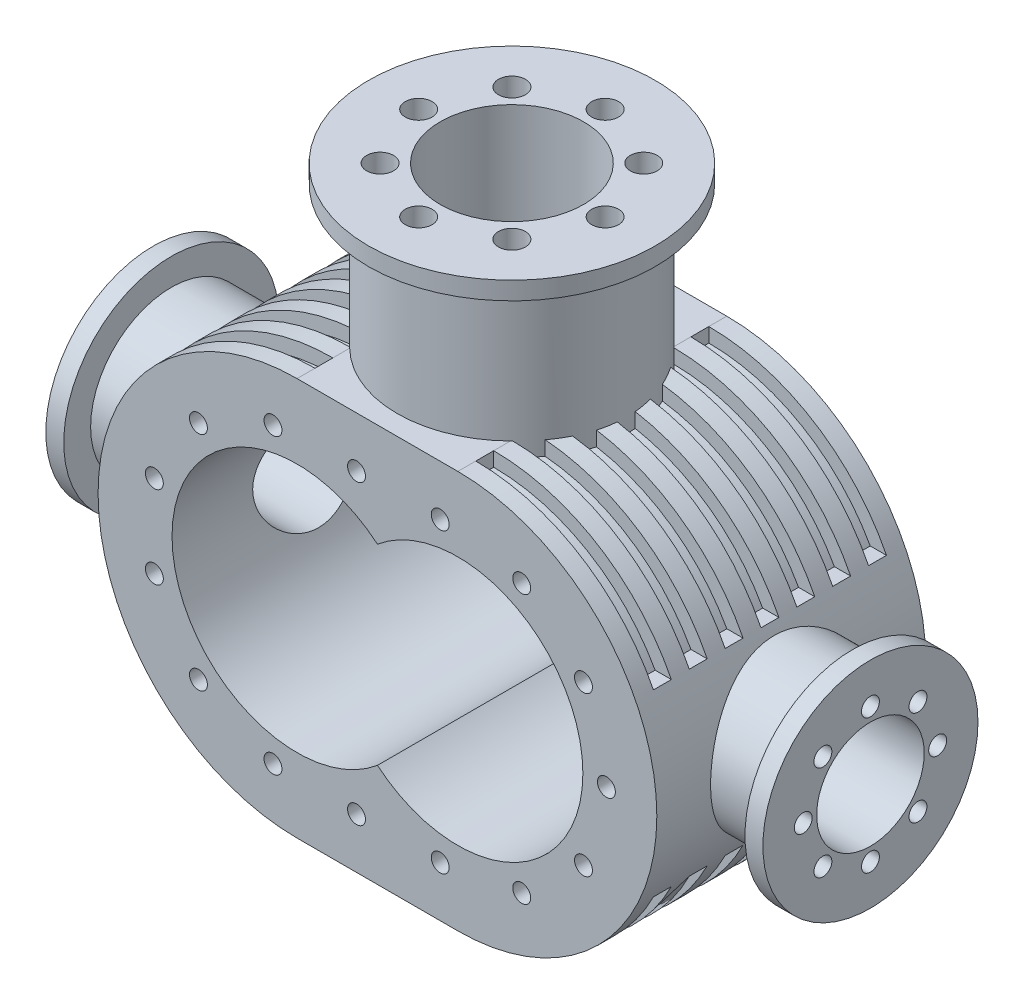
from build123d import *

# Parameters (mm, degrees)
BOSS_EXTRUDE1_DEPTH      = 75
SKETCH3_R                = 5
CUT_EXTRUDE1_DEPTH       = 30
CRVPATTERN1_START        = 45
CRVPATTERN1_OUTLINE_R    = 5
CRVPATTERN1_DEPTH        = 30
BOSS_EXTRUDE2_REACH      = 382.226
BOSS_EXTRUDE2_END_RADIUS = 111
SKETCH4_R                = 45
SKETCH4_3_R              = 60
SKETCH4_3_R_2            = 45
BOSS_EXTRUDE3_DEPTH      = 10
CUT_EXTRUDE2_REACH       = 382.226
CUT_EXTRUDE2_END_RADIUS  = 69.75
SKETCH4_4_R              = 30
SKETCH5_R                = 5
CUT_EXTRUDE3_DEPTH       = 30
SKETCH6_R                = 64
SKETCH6_R_2              = 40
BOSS_EXTRUDE6_DEPTH      = 89
CUT_EXTRUDE4_REACH       = 379.288
SKETCH6_4_R              = 40
SKETCH6_5_R              = 80
SKETCH6_5_R_2            = 64
BOSS_EXTRUDE9_DEPTH      = 10
SKETCH12_R               = 7.5
CUT_EXTRUDE5_DEPTH       = 40
CUT_EXTRUDE6_DEPTH       = 294.93876927
CUT_EXTRUDE6_DEPTH_BACK  = 294.93876927
BOSS_EXTRUDE11_START     = -10
BOSS_EXTRUDE11_DEPTH     = 10
CUT_EXTRUDE7_DEPTH       = 323.529068581
CUT_EXTRUDE7_DEPTH_BACK  = 10
SKETCH18_R               = 10
BOSS_EXTRUDE12_START     = 65
BOSS_EXTRUDE12_DEPTH     = 10
LPATTERN1_COUNT          = 8
LPATTERN1_PITCH          = 20
BOSS_EXTRUDE13_REACH     = 311.328


# Read off the part's stored shape, not the designer's step: CrvPattern1
with BuildPart() as part:
    # Sketch1 → Boss-Extrude1 (new, symmetric)
    with BuildSketch(Plane.XY):
        with BuildLine():
            Line((-44.845, -111), (44.845, -111))
            ThreePointArc((44.845, -111), (155.845, 0), (44.845, 111))
            Line((44.845, 111), (-44.845, 111))
            ThreePointArc((-44.845, 111), (-155.845, 0), (-44.845, -111))
        make_face()
        with BuildLine():
            ThreePointArc((0, -53.422733691), (114.595, 0), (0, 53.422733691))
            ThreePointArc((0, 53.422733691), (-114.595, 0), (0, -53.422733691))
        make_face(mode=Mode.SUBTRACT)
    extrude(amount=BOSS_EXTRUDE1_DEPTH, both=True)

    # Sketch3 → Cut-Extrude1 (cut)
    with BuildSketch(Plane.XY.offset(75)):
        with Locations((127.72, 0)):
            Circle(SKETCH3_R)
    extrude(amount=-CUT_EXTRUDE1_DEPTH, mode=Mode.SUBTRACT)

    # CrvPattern1 outline → CrvPattern1 (cut)
    with BuildSketch(Plane.XY.offset(CRVPATTERN1_START)):
        with Locations((114.921070285, 44.244886692)):
            Circle(CRVPATTERN1_OUTLINE_R)
        with Locations((114.921070285, -44.244886692)):
            Circle(CRVPATTERN1_OUTLINE_R)
        with Locations((80.477526434, -74.823717396)):
            Circle(CRVPATTERN1_OUTLINE_R)
        with Locations((35.004949117, -82.875)):
            Circle(CRVPATTERN1_OUTLINE_R)
        with Locations((-11.668316372, -82.875)):
            Circle(CRVPATTERN1_OUTLINE_R)
        with Locations((-58.282002325, -81.778435993)):
            Circle(CRVPATTERN1_OUTLINE_R)
        with Locations((-99.866296576, -61.97517687)):
            Circle(CRVPATTERN1_OUTLINE_R)
        with Locations((-124.455991546, -23.029451797)):
            Circle(CRVPATTERN1_OUTLINE_R)
        with Locations((-124.455991546, 23.029451797)):
            Circle(CRVPATTERN1_OUTLINE_R)
        with Locations((-99.866296576, 61.97517687)):
            Circle(CRVPATTERN1_OUTLINE_R)
        with Locations((-58.282002325, 81.778435993)):
            Circle(CRVPATTERN1_OUTLINE_R)
        with Locations((-11.668316372, 82.875)):
            Circle(CRVPATTERN1_OUTLINE_R)
        with Locations((35.004949117, 82.875)):
            Circle(CRVPATTERN1_OUTLINE_R)
        with Locations((80.477526434, 74.823717396)):
            Circle(CRVPATTERN1_OUTLINE_R)
    extrude(amount=CRVPATTERN1_DEPTH, mode=Mode.SUBTRACT)

    # Boss-Extrude2: up to this cylinder (the profile starts outside it)
    boss_extrude2_end = Plane(origin=(44.845, 0, 0), z_dir=(0, 0, -1)) * Cylinder(BOSS_EXTRUDE2_END_RADIUS, 987.452, mode=Mode.PRIVATE)
    # Sketch4 → Boss-Extrude2 (add, up to the surface)
    with BuildSketch(Plane(origin=(200, 0, 0), x_dir=(0, 0, -1), z_dir=(1, 0, 0)), mode=Mode.PRIVATE) as boss_extrude2_sk1:
        Circle(SKETCH4_R)
    boss_extrude2_tool1 = extrude(boss_extrude2_sk1.sketch, amount=-BOSS_EXTRUDE2_REACH, mode=Mode.PRIVATE) - boss_extrude2_end
    boss_extrude2 = boss_extrude2_tool1.solids().sort_by_distance((200, 0, 0))[0]
    add(boss_extrude2)

    # Sketch4<3> → Boss-Extrude3 (add)
    with BuildSketch(Plane(origin=(200, 0, 0), x_dir=(0, 0, -1), z_dir=(1, 0, 0))):
        Circle(SKETCH4_3_R)
        Circle(SKETCH4_3_R_2, mode=Mode.SUBTRACT)
    boss_extrude3 = extrude(amount=-BOSS_EXTRUDE3_DEPTH)

    # Cut-Extrude2: up to this cylinder (the profile starts outside it)
    cut_extrude2_end = Plane(origin=(44.845, 0, 0), z_dir=(0, 0, -1)) * Cylinder(CUT_EXTRUDE2_END_RADIUS, 904.952, mode=Mode.PRIVATE)
    # Sketch4<4> → Cut-Extrude2 (cut, up to the surface)
    with BuildSketch(Plane(origin=(200, 0, 0), x_dir=(0, 0, -1), z_dir=(1, 0, 0)), mode=Mode.PRIVATE) as cut_extrude2_sk1:
        Circle(SKETCH4_4_R)
    cut_extrude2_tool1 = extrude(cut_extrude2_sk1.sketch, amount=-CUT_EXTRUDE2_REACH, mode=Mode.PRIVATE) - cut_extrude2_end
    cut_extrude2 = cut_extrude2_tool1.solids().sort_by_distance((200, 0, 0))[0]
    add(cut_extrude2, mode=Mode.SUBTRACT)

    # Sketch5 → Cut-Extrude3 (cut)
    with BuildSketch(Plane(origin=(200, 0, 0), x_dir=(0, 0, -1), z_dir=(1, 0, 0))):
        with Locations((0, 37.5)):
            Circle(SKETCH5_R)
        with Locations((26.516504294, 26.516504294)):
            Circle(SKETCH5_R)
        with Locations((37.5, 0)):
            Circle(SKETCH5_R)
        with Locations((26.516504294, -26.516504294)):
            Circle(SKETCH5_R)
        with Locations((0, -37.5)):
            Circle(SKETCH5_R)
        with Locations((-26.516504294, -26.516504294)):
            Circle(SKETCH5_R)
        with Locations((-37.5, 0)):
            Circle(SKETCH5_R)
        with Locations((-26.516504294, 26.516504294)):
            Circle(SKETCH5_R)
    cut_extrude3 = extrude(amount=-CUT_EXTRUDE3_DEPTH, mode=Mode.SUBTRACT)

    # Mirror1: Boss-Extrude2, Boss-Extrude3, Cut-Extrude2, Cut-Extrude3 across plane
    add(boss_extrude2.mirror(Plane(origin=(0, 0, 0), x_dir=(0, 0, 1), z_dir=(1, 0, 0))))
    add(boss_extrude3.mirror(Plane(origin=(0, 0, 0), x_dir=(0, 0, 1), z_dir=(1, 0, 0))))
    add(cut_extrude2.mirror(Plane(origin=(0, 0, 0), x_dir=(0, 0, 1), z_dir=(1, 0, 0))), mode=Mode.SUBTRACT)
    add(cut_extrude3.mirror(Plane(origin=(0, 0, 0), x_dir=(0, 0, 1), z_dir=(1, 0, 0))), mode=Mode.SUBTRACT)

    # Sketch6 → Boss-Extrude6 (add)
    # profile 1 of 2: a face of its own
    with BuildSketch(Plane(origin=(0, 200, 0), x_dir=(1, 0, 0), z_dir=(0, 1, 0))):
        with Locations(Location((0, 0, 0), (0, 0, 270))):
            Circle(SKETCH6_R)
        Circle(SKETCH6_R_2, mode=Mode.SUBTRACT)
    # profile 2 of 2: a face of its own
    with BuildSketch(Plane(origin=(0, 200, 0), x_dir=(1, 0, 0), z_dir=(0, 1, 0))):
        Circle(SKETCH6_R_2)
    extrude(amount=-BOSS_EXTRUDE6_DEPTH)

    # Sketch6<4> → Cut-Extrude4 (cut, up to next)
    with BuildSketch(Plane(origin=(0, 200, 0), x_dir=(1, 0, 0), z_dir=(0, 1, 0)), mode=Mode.PRIVATE) as cut_extrude4_sk1:
        with Locations(Location((0, 0, 0), (0, 0, 270))):
            Circle(SKETCH6_4_R)
    cut_extrude4_tool1 = extrude(cut_extrude4_sk1.sketch, amount=-CUT_EXTRUDE4_REACH, mode=Mode.PRIVATE) & part.part
    add(cut_extrude4_tool1.solids().sort_by_distance((0, 200, 0))[0], mode=Mode.SUBTRACT)

    # Sketch6<5> → Boss-Extrude9 (add)
    with BuildSketch(Plane(origin=(0, 200, 0), x_dir=(1, 0, 0), z_dir=(0, 1, 0))):
        with Locations(Location((0, 0, 0), (0, 0, 270))):
            Circle(SKETCH6_5_R)
        with Locations(Location((0, 0, 0), (0, 0, 270))):
            Circle(SKETCH6_5_R_2, mode=Mode.SUBTRACT)
    extrude(amount=-BOSS_EXTRUDE9_DEPTH)

    # Sketch12 → Cut-Extrude5 (cut)
    with BuildSketch(Plane(origin=(0, 200, 0), x_dir=(1, 0, 0), z_dir=(0, 1, 0))):
        with Locations(Location((52, 0, 0), (0, 0, 270))):
            Circle(SKETCH12_R)
        with Locations(Location((36.769552622, -36.769552622, 0), (0, 0, 270))):
            Circle(SKETCH12_R)
        with Locations(Location((0, -52, 0), (0, 0, 270))):
            Circle(SKETCH12_R)
        with Locations(Location((-36.769552622, -36.769552622, 0), (0, 0, 270))):
            Circle(SKETCH12_R)
        with Locations(Location((-52, 0, 0), (0, 0, 270))):
            Circle(SKETCH12_R)
        with Locations(Location((-36.769552622, 36.769552622, 0), (0, 0, 270))):
            Circle(SKETCH12_R)
        with Locations(Location((0, 52, 0), (0, 0, 270))):
            Circle(SKETCH12_R)
        with Locations(Location((36.769552622, 36.769552622, 0), (0, 0, 270))):
            Circle(SKETCH12_R)
    extrude(amount=-CUT_EXTRUDE5_DEPTH, mode=Mode.SUBTRACT)

    # Sketch15 → Cut-Extrude6 (cut, two sides: drawn at the far end of the back side and taken through both)
    with BuildSketch(Plane.XY.offset(-CUT_EXTRUDE6_DEPTH_BACK)):
        with BuildLine():
            ThreePointArc((-44.845, 111), (-103.030049626, 94.527773696), (-143.945958623, 50))
            Line((-143.945958623, 50), (-134.894986119, 50))
            ThreePointArc((-134.894986119, 50), (-97.089616948, 88.766547753), (-44.845, 103))
            Line((-44.845, 103), (-44.845, 111))
        make_face()
        with BuildLine():
            Line((134.894986119, 50), (143.945958623, 50))
            ThreePointArc((143.945958623, 50), (103.030049626, 94.527773696), (44.845, 111))
            Line((44.845, 111), (44.845, 103))
            ThreePointArc((44.845, 103), (97.089616948, 88.766547753), (134.894986119, 50))
        make_face()
        with BuildLine():
            Line((44.845, -103), (44.845, -111))
            ThreePointArc((44.845, -111), (103.030049626, -94.527773696), (143.945958623, -50))
            Line((143.945958623, -50), (134.894986119, -50))
            ThreePointArc((134.894986119, -50), (97.089616948, -88.766547753), (44.845, -103))
        make_face()
        with BuildLine():
            ThreePointArc((-143.945958623, -50), (-103.030049626, -94.527773696), (-44.845, -111))
            Line((-44.845, -111), (-44.845, -103))
            ThreePointArc((-44.845, -103), (-97.089616948, -88.766547753), (-134.894986119, -50))
            Line((-134.894986119, -50), (-143.945958623, -50))
        make_face()
    extrude(amount=CUT_EXTRUDE6_DEPTH + CUT_EXTRUDE6_DEPTH_BACK, mode=Mode.SUBTRACT)

    # Sketch17 → Boss-Extrude11 (add)
    with BuildSketch(Plane(origin=(0, 0, -75), x_dir=(-1, 0, 0), z_dir=(0, 0, -1)).offset(BOSS_EXTRUDE11_START)):
        with BuildLine():
            ThreePointArc((0, -53.422733691), (114.595, 0), (0, 53.422733691))
            ThreePointArc((0, 53.422733691), (-114.595, 0), (0, -53.422733691))
        make_face()
    extrude(amount=BOSS_EXTRUDE11_DEPTH)

    # Sketch18 → Cut-Extrude7 (cut, two sides: drawn at the far end of the back side and taken through both)
    with BuildSketch(Plane(origin=(0, 0, -75), x_dir=(-1, 0, 0), z_dir=(0, 0, -1)).offset(-CUT_EXTRUDE7_DEPTH_BACK)):
        with Locations(Location((-44.845, 0, 0), (0, 0, 180))):
            Circle(SKETCH18_R)
        with Locations(Location((44.845, 0, 0), (0, 0, 180))):
            Circle(SKETCH18_R)
    extrude(amount=CUT_EXTRUDE7_DEPTH + CUT_EXTRUDE7_DEPTH_BACK, mode=Mode.SUBTRACT)

    # Sketch15<3> → Boss-Extrude12 (add)
    with BuildSketch(Plane.XY.offset(BOSS_EXTRUDE12_START)):
        with BuildLine():
            ThreePointArc((-44.845, 111), (-103.030049626, 94.527773696), (-143.945958623, 50))
            Line((-143.945958623, 50), (-134.894986119, 50))
            ThreePointArc((-134.894986119, 50), (-97.089616948, 88.766547753), (-44.845, 103))
            Line((-44.845, 103), (-44.845, 111))
        make_face()
        with BuildLine():
            Line((134.894986119, 50), (143.945958623, 50))
            ThreePointArc((143.945958623, 50), (103.030049626, 94.527773696), (44.845, 111))
            Line((44.845, 111), (44.845, 103))
            ThreePointArc((44.845, 103), (97.089616948, 88.766547753), (134.894986119, 50))
        make_face()
        with BuildLine():
            Line((44.845, -103), (44.845, -111))
            ThreePointArc((44.845, -111), (103.030049626, -94.527773696), (143.945958623, -50))
            Line((143.945958623, -50), (134.894986119, -50))
            ThreePointArc((134.894986119, -50), (97.089616948, -88.766547753), (44.845, -103))
        make_face()
        with BuildLine():
            ThreePointArc((-143.945958623, -50), (-103.030049626, -94.527773696), (-44.845, -111))
            Line((-44.845, -111), (-44.845, -103))
            ThreePointArc((-44.845, -103), (-97.089616948, -88.766547753), (-134.894986119, -50))
            Line((-134.894986119, -50), (-143.945958623, -50))
        make_face()
    boss_extrude12 = extrude(amount=BOSS_EXTRUDE12_DEPTH)

    # LPattern1: Boss-Extrude12 ×8
    with Locations(*[(0, 0, -i * LPATTERN1_PITCH) for i in range(1, LPATTERN1_COUNT)]):
        add(boss_extrude12)

    # Sketch19 → Boss-Extrude13 (add, up to next)
    with BuildSketch(Plane.XZ.offset(-111), mode=Mode.PRIVATE) as boss_extrude13_sk1:
        with BuildLine():
            Line((44.845, 45.660989641), (44.845, 45))
            Line((44.845, 45), (44.845, 35))
            Line((44.845, 35), (44.845, 25))
            Line((44.845, 25), (44.845, 15))
            Line((44.845, 15), (44.845, 5))
            Line((44.845, 5), (44.845, -5))
            Line((44.845, -5), (44.845, -15))
            Line((44.845, -15), (44.845, -25))
            Line((44.845, -25), (44.845, -35))
            Line((44.845, -35), (44.845, -45))
            Line((44.845, -45), (44.845, -45.660989641))
            ThreePointArc((44.845, -45.660989641), (64, 0), (44.845, 45.660989641))
        make_face()
    boss_extrude13_tool1 = extrude(boss_extrude13_sk1.sketch, amount=BOSS_EXTRUDE13_REACH, mode=Mode.PRIVATE) - part.part
    # Sketch19 → Boss-Extrude13 (add, up to next)
    with BuildSketch(Plane.XZ.offset(-111), mode=Mode.PRIVATE) as boss_extrude13_sk2:
        with BuildLine():
            Line((-44.845, 45), (-44.845, 45.660989641))
            ThreePointArc((-44.845, 45.660989641), (-64, 0), (-44.845, -45.660989641))
            Line((-44.845, -45.660989641), (-44.845, -45))
            Line((-44.845, -45), (-44.845, -35))
            Line((-44.845, -35), (-44.845, -25))
            Line((-44.845, -25), (-44.845, -15))
            Line((-44.845, -15), (-44.845, -5))
            Line((-44.845, -5), (-44.845, 5))
            Line((-44.845, 5), (-44.845, 15))
            Line((-44.845, 15), (-44.845, 25))
            Line((-44.845, 25), (-44.845, 35))
            Line((-44.845, 35), (-44.845, 45))
        make_face()
    boss_extrude13_tool2 = extrude(boss_extrude13_sk2.sketch, amount=BOSS_EXTRUDE13_REACH, mode=Mode.PRIVATE) - part.part
    add(boss_extrude13_tool1.solids().sort_by_distance((52.614656, 111, 0))[0])
    add(boss_extrude13_tool2.solids().sort_by_distance((-52.614656, 111, 0))[0])


solid = part.part
